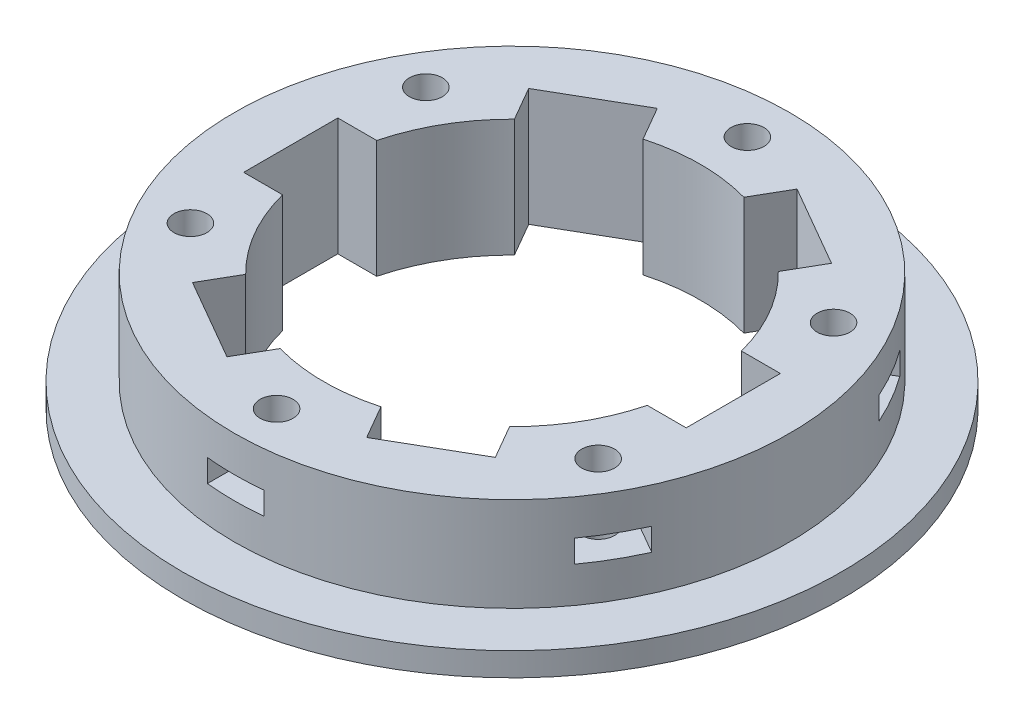
from build123d import *

# Parameters (mm, degrees)
SKETCH1_R               = 35
SKETCH1_R_2             = 20
BOSS_EXTRUDE1_DEPTH     = 2.5
SKETCH2_R               = 29.5
SKETCH2_R_2             = 20
BOSS_EXTRUDE2_DEPTH     = 10
SKETCH4_R               = 1.75
CUT_EXTRUDE2_DEPTH      = 52.051444642
CUT_EXTRUDE1_DEPTH      = 52.051444642
CUT_EXTRUDE3_DEPTH      = 1.2
CUT_EXTRUDE3_DEPTH_BACK = 1.2


with BuildPart() as part:
    # Sketch1 → Boss-Extrude1 (new body)
    with BuildSketch(Plane(origin=(0, 0, 0), x_dir=(1, 0, 0), z_dir=(0, 1, 0))):
        Circle(SKETCH1_R)
        Circle(SKETCH1_R_2, mode=Mode.SUBTRACT)
    extrude(amount=BOSS_EXTRUDE1_DEPTH)

    # Sketch2 → Boss-Extrude2 (add)
    with BuildSketch(Plane(origin=(0, 2.5, 0), x_dir=(1, 0, 0), z_dir=(0, 1, 0))):
        Circle(SKETCH2_R)
        Circle(SKETCH2_R_2, mode=Mode.SUBTRACT)
    extrude(amount=BOSS_EXTRUDE2_DEPTH)

    # Sketch4 → Cut-Extrude2 (cut, through all)
    with BuildSketch(Plane(origin=(0, 12.5, 0), x_dir=(1, 0, 0), z_dir=(0, 1, 0))):
        with Locations((-21.650635095, -12.5)):
            Circle(SKETCH4_R)
        with Locations((-21.650635095, 12.5)):
            Circle(SKETCH4_R)
        with Locations((0, 25)):
            Circle(SKETCH4_R)
        with Locations((21.650635095, 12.5)):
            Circle(SKETCH4_R)
        with Locations((21.650635095, -12.5)):
            Circle(SKETCH4_R)
        with Locations((0, -25)):
            Circle(SKETCH4_R)
    extrude(amount=-CUT_EXTRUDE2_DEPTH, mode=Mode.SUBTRACT)

    # Sketch3 → Cut-Extrude1 (cut, through all)
    with BuildSketch(Plane(origin=(0, 12.5, 0), x_dir=(1, 0, 0), z_dir=(0, 1, 0))):
        with BuildLine():
            Line((-19.364916731, 5), (-23.5, 5))
            Line((-23.5, 5), (-23.5, -5))
            Line((-23.5, -5), (-19.364916731, -5))
            ThreePointArc((-19.364916731, -5), (-20, 0), (-19.364916731, 5))
        make_face()
        with BuildLine():
            Line((-5.352331347, 19.270509831), (-7.419872981, 22.851596989))
            Line((-7.419872981, 22.851596989), (-16.080127019, 17.851596989))
            Line((-16.080127019, 17.851596989), (-14.012585384, 14.270509831))
            ThreePointArc((-14.012585384, 14.270509831), (-10, 17.320508076), (-5.352331347, 19.270509831))
        make_face()
        with BuildLine():
            Line((14.012585384, 14.270509831), (16.080127019, 17.851596989))
            Line((16.080127019, 17.851596989), (7.419872981, 22.851596989))
            Line((7.419872981, 22.851596989), (5.352331347, 19.270509831))
            ThreePointArc((5.352331347, 19.270509831), (10, 17.320508076), (14.012585384, 14.270509831))
        make_face()
        with BuildLine():
            Line((19.364916731, -5), (23.5, -5))
            Line((23.5, -5), (23.5, 5))
            Line((23.5, 5), (19.364916731, 5))
            ThreePointArc((19.364916731, 5), (20, 0), (19.364916731, -5))
        make_face()
        with BuildLine():
            Line((5.352331347, -19.270509831), (7.419872981, -22.851596989))
            Line((7.419872981, -22.851596989), (16.080127019, -17.851596989))
            Line((16.080127019, -17.851596989), (14.012585384, -14.270509831))
            ThreePointArc((14.012585384, -14.270509831), (10, -17.320508076), (5.352331347, -19.270509831))
        make_face()
        with BuildLine():
            Line((-14.012585384, -14.270509831), (-16.080127019, -17.851596989))
            Line((-16.080127019, -17.851596989), (-7.419872981, -22.851596989))
            Line((-7.419872981, -22.851596989), (-5.352331347, -19.270509831))
            ThreePointArc((-5.352331347, -19.270509831), (-10, -17.320508076), (-14.012585384, -14.270509831))
        make_face()
    extrude(amount=-CUT_EXTRUDE1_DEPTH, mode=Mode.SUBTRACT)

    # Sketch7 → Cut-Extrude3 (cut, two sides: drawn at the far end of the back side and taken through both)
    with BuildSketch(Plane(origin=(0, 7.5, 0), x_dir=(1, 0, 0), z_dir=(0, 1, 0)).offset(-CUT_EXTRUDE3_DEPTH_BACK)):
        with BuildLine():
            Line((-18.650635095, -10.767949192), (-21.650635095, -9.035898385))
            Line((-21.650635095, -9.035898385), (-26.91530051, -12.075454379))
            ThreePointArc((-26.91530051, -12.075454379), (-25.547749412, -14.75), (-23.91530051, -17.271606802))
            Line((-23.91530051, -17.271606802), (-18.650635095, -14.232050808))
            Line((-18.650635095, -14.232050808), (-18.650635095, -10.767949192))
        make_face()
        with BuildLine():
            Line((0, -21.535898385), (-3, -23.267949192))
            Line((-3, -23.267949192), (-3, -29.347061182))
            ThreePointArc((-3, -29.347061182), (0, -29.5), (3, -29.347061182))
            Line((3, -29.347061182), (3, -23.267949192))
            Line((3, -23.267949192), (0, -21.535898385))
        make_face()
        with BuildLine():
            Line((-18.650635095, 10.767949192), (-18.650635095, 14.232050808))
            Line((-18.650635095, 14.232050808), (-23.91530051, 17.271606802))
            ThreePointArc((-23.91530051, 17.271606802), (-25.547749412, 14.75), (-26.91530051, 12.075454379))
            Line((-26.91530051, 12.075454379), (-21.650635095, 9.035898385))
            Line((-21.650635095, 9.035898385), (-18.650635095, 10.767949192))
        make_face()
        with BuildLine():
            Line((0, 21.535898385), (3, 23.267949192))
            Line((3, 23.267949192), (3, 29.347061182))
            ThreePointArc((3, 29.347061182), (0, 29.5), (-3, 29.347061182))
            Line((-3, 29.347061182), (-3, 23.267949192))
            Line((-3, 23.267949192), (0, 21.535898385))
        make_face()
        with BuildLine():
            Line((18.650635095, 10.767949192), (21.650635095, 9.035898385))
            Line((21.650635095, 9.035898385), (26.91530051, 12.075454379))
            ThreePointArc((26.91530051, 12.075454379), (25.547749412, 14.75), (23.91530051, 17.271606802))
            Line((23.91530051, 17.271606802), (18.650635095, 14.232050808))
            Line((18.650635095, 14.232050808), (18.650635095, 10.767949192))
        make_face()
        with BuildLine():
            Line((18.650635095, -10.767949192), (18.650635095, -14.232050808))
            Line((18.650635095, -14.232050808), (23.91530051, -17.271606802))
            ThreePointArc((23.91530051, -17.271606802), (25.547749412, -14.75), (26.91530051, -12.075454379))
            Line((26.91530051, -12.075454379), (21.650635095, -9.035898385))
            Line((21.650635095, -9.035898385), (18.650635095, -10.767949192))
        make_face()
    extrude(amount=CUT_EXTRUDE3_DEPTH + CUT_EXTRUDE3_DEPTH_BACK, mode=Mode.SUBTRACT)


solid = part.part
